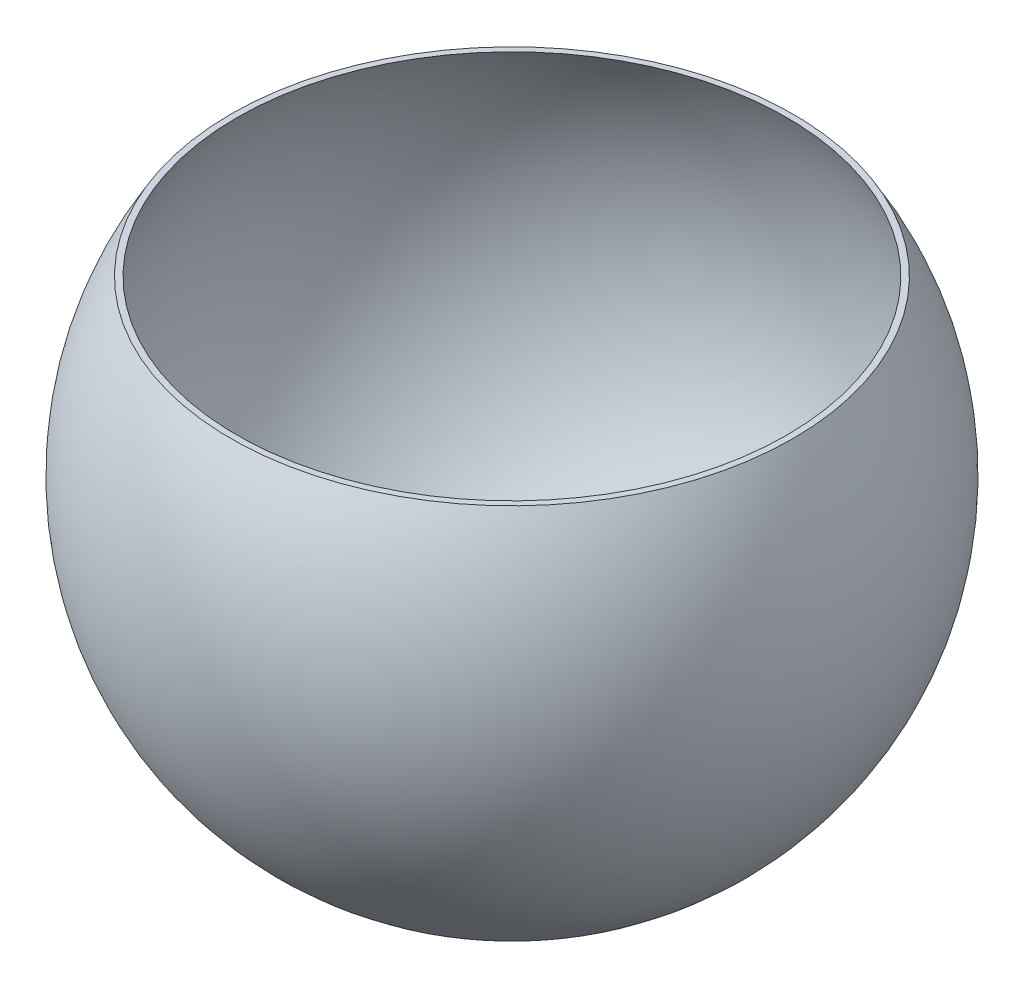
from build123d import *


with BuildPart() as part:
    # Sketch1 → Revolve1 (revolve)
    with BuildSketch(Plane.XY):
        with BuildLine():
            Line((173.273483179, 198.063736754), (169.538964836, 198.063736754))
            ThreePointArc((169.538964836, 198.063736754), (174.987779601, -4.978507116), (0, -108.105222222))
            Line((0, -108.105222222), (0, -111.280222222))
            ThreePointArc((0, -111.280222222), (177.283237312, -7.382255273), (173.273483179, 198.063736754))
        make_face()
    revolve(axis=Axis((0, 0, 0), (0, -1, 0)))


solid = part.part
